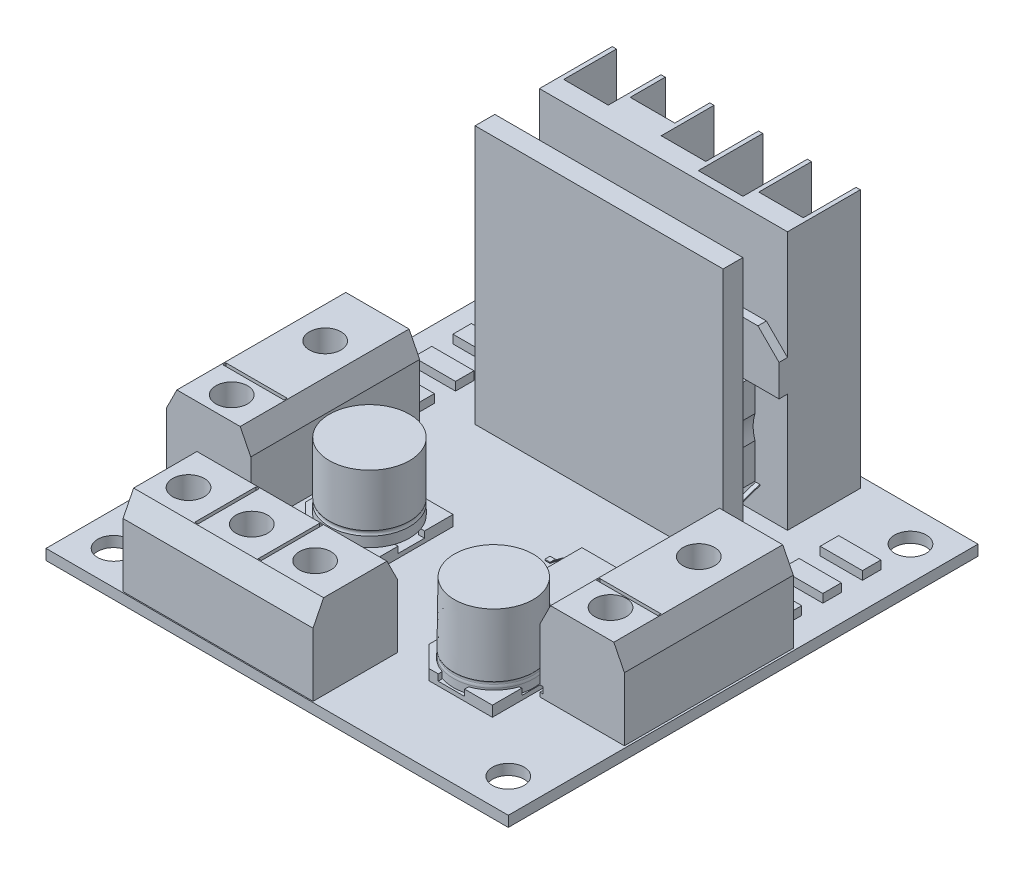
from build123d import *

# Parameters (mm, degrees)
SKETCH1_W                      = 43.8
SKETCH1_H                      = 44.5
BOSS_EXTRUDE1_DEPTH            = 1
SKETCH2_R                      = 1.5
CUT_EXTRUDE1_DEPTH             = 32.235756754
SKETCH3_W                      = 23.5
SKETCH3_H                      = 13
BOSS_EXTRUDE2_DEPTH            = 24.5
SKETCH4_W                      = 4.22
SKETCH4_H                      = 5
SKETCH4_H_2                    = 6.1
SKETCH4_H_3                    = 3.317704122
SKETCH4_W_2                    = 24.880307256
SKETCH4_H_4                    = 4.229463958
CUT_EXTRUDE2_DEPTH             = 24.5
SKETCH6_W                      = 17.564642357
SKETCH6_H                      = 8.68402444
BOSS_EXTRUDE3_DEPTH            = 2.5
CUT_EXTRUDE4_DEPTH             = 2.5
CUT_EXTRUDE5_DEPTH             = 2.5
SKETCH7_4_R                    = 0.503382287
CUT_EXTRUDE6_DEPTH             = 0.5
SKETCH7_5_R                    = 0.503382287
CUT_EXTRUDE7_DEPTH             = 0.5
BOSS_EXTRUDE4_DEPTH            = 0.8
CUT_EXTRUDE8_START             = -2.7
SKETCH9_R                      = 0.75
CUT_EXTRUDE8_DEPTH             = 2.7
SKETCH10_W                     = 8
SKETCH10_H                     = 16
BOSS_EXTRUDE5_DEPTH            = 8
CUT_EXTRUDE10_DEPTH            = 48.315430887
CUT_EXTRUDE11_DEPTH            = 48.315430887
SKETCH15_W                     = 5.8
SKETCH15_H                     = 0.3
CUT_EXTRUDE_THIN1_DEPTH        = 0.3
SKETCH16_W                     = 5.8
SKETCH16_H                     = 0.3
CUT_EXTRUDE_THIN2_DEPTH        = 0.3
SKETCH17_R                     = 1.5
CUT_EXTRUDE12_DEPTH            = 8
SKETCH18_W                     = 18
SKETCH18_H                     = 8
BOSS_EXTRUDE6_DEPTH            = 8
CUT_EXTRUDE13_DEPTH            = 50.848495464
SKETCH24_W                     = 0.3
SKETCH24_H                     = 5.8
CUT_EXTRUDE_THIN4_DEPTH        = 0.3
SKETCH25_R                     = 1.5
CUT_EXTRUDE14_DEPTH            = 8
BOSS_EXTRUDE8_DEPTH            = 0.3
SKETCH35_W                     = 7.841197797
SKETCH35_H                     = 7.810978509
BOSS_EXTRUDE9_DEPTH            = 0.8
BOSS_EXTRUDE11_START           = -1.5
BOSS_EXTRUDE11_DEPTH           = 0.3
BOSS_EXTRUDE12_START           = -6.5
BOSS_EXTRUDE12_DEPTH           = 0.3
BOSS_EXTRUDE13_START           = -4
BOSS_EXTRUDE13_DEPTH           = 0.3
BOSS_EXTRUDE14_DEPTH           = 1
CUT_EXTRUDE16_DEPTH            = 0.6
CUT_EXTRUDE17_START            = -1.4
SKETCH43_R                     = 0.15
CUT_EXTRUDE17_DEPTH            = 1.4
FILLET1_R                      = 1
SKETCH53_W                     = 4
SKETCH53_H                     = 1.75
BOSS_EXTRUDE18_DEPTH           = 0.8
SKETCH55_W                     = 0.5011709
SKETCH55_H                     = 0.5
BOSS_EXTRUDE20_DEPTH           = 0.1
BOSS_EXTRUDE21_DEPTH           = 1
CUT_EXTRUDE18_DEPTH            = 0.6
EXTRUDE_THIN1_START            = -3
EXTRUDE_THIN1_DEPTH            = 0.4
EXTRUDE_THIN9_START            = -6
EXTRUDE_THIN9_DEPTH            = 0.2
EXTRUDE_THIN11_START           = -8.6
EXTRUDE_THIN11_DEPTH           = 0.4
EXTRUDE_THIN13_START           = -12
EXTRUDE_THIN13_DEPTH           = 0.2
EXTRUDE_THIN14_START           = -15
EXTRUDE_THIN14_DEPTH           = 0.2
EXTRUDE_THIN15_START           = -18
EXTRUDE_THIN15_DEPTH           = 0.2
EXTRUDE_THIN16_START           = -21
EXTRUDE_THIN16_DEPTH           = 0.2
EXTRUDE_THIN17_START           = -24
EXTRUDE_THIN17_DEPTH           = 0.2
SKETCH158_R                    = 0.462614831
BOSS_EXTRUDE22_DEPTH           = 1
BOSS_EXTRUDE22_DRAFT           = 5
BOSS_EXTRUDE22_PROFILE_2_DEPTH = 1
BOSS_EXTRUDE22_PROFILE_2_DRAFT = 5
BOSS_EXTRUDE22_PROFILE_3_DEPTH = 1
BOSS_EXTRUDE22_PROFILE_3_DRAFT = 5
BOSS_EXTRUDE22_PROFILE_4_DEPTH = 1
BOSS_EXTRUDE22_PROFILE_4_DRAFT = 5
BOSS_EXTRUDE22_PROFILE_5_DEPTH = 1
BOSS_EXTRUDE22_PROFILE_5_DRAFT = 5
BOSS_EXTRUDE22_PROFILE_6_DEPTH = 1
BOSS_EXTRUDE22_PROFILE_6_DRAFT = 5
BOSS_EXTRUDE22_PROFILE_7_DEPTH = 1
BOSS_EXTRUDE22_PROFILE_7_DRAFT = 5
BOSS_EXTRUDE22_PROFILE_8_DEPTH = 1
BOSS_EXTRUDE22_PROFILE_8_DRAFT = 5
SKETCH160_R                    = 0.2
BOSS_EXTRUDE23_DEPTH           = 1
BOSS_EXTRUDE23_DRAFT           = 5
BOSS_EXTRUDE23_PROFILE_2_DEPTH = 1
BOSS_EXTRUDE23_PROFILE_2_DRAFT = 5
BOSS_EXTRUDE23_PROFILE_3_DEPTH = 1
BOSS_EXTRUDE23_PROFILE_3_DRAFT = 5
BOSS_EXTRUDE23_PROFILE_4_DEPTH = 1
BOSS_EXTRUDE23_PROFILE_4_DRAFT = 5
BOSS_EXTRUDE23_PROFILE_5_DEPTH = 1
BOSS_EXTRUDE23_PROFILE_5_DRAFT = 5
BOSS_EXTRUDE23_PROFILE_6_DEPTH = 1
BOSS_EXTRUDE23_PROFILE_6_DRAFT = 5
BOSS_EXTRUDE23_PROFILE_7_DEPTH = 1
BOSS_EXTRUDE23_PROFILE_7_DRAFT = 5
SKETCH156_R                    = 0.35
BOSS_EXTRUDE24_DEPTH           = 1
BOSS_EXTRUDE24_DRAFT           = 5
BOSS_EXTRUDE24_PROFILE_2_DEPTH = 1
BOSS_EXTRUDE24_PROFILE_2_DRAFT = 5
SKETCH141_R                    = 0.15
BOSS_EXTRUDE25_DEPTH           = 1
BOSS_EXTRUDE25_DRAFT           = 5
BOSS_EXTRUDE25_PROFILE_2_DEPTH = 1
BOSS_EXTRUDE25_PROFILE_2_DRAFT = 5
SKETCH138_R                    = 0.35
BOSS_EXTRUDE26_DEPTH           = 1
BOSS_EXTRUDE26_DRAFT           = 5
BOSS_EXTRUDE26_PROFILE_2_DEPTH = 1
BOSS_EXTRUDE26_PROFILE_2_DRAFT = 5
BOSS_EXTRUDE26_PROFILE_3_DEPTH = 1
BOSS_EXTRUDE26_PROFILE_3_DRAFT = 5
BOSS_EXTRUDE26_PROFILE_4_DEPTH = 1
BOSS_EXTRUDE26_PROFILE_4_DRAFT = 5
SKETCH102_R                    = 1.268566962
BOSS_EXTRUDE27_DEPTH           = 1
BOSS_EXTRUDE27_DRAFT           = -5
SKETCH150_R                    = 0.5
BOSS_EXTRUDE28_DEPTH           = 1
BOSS_EXTRUDE28_DRAFT           = 5
BOSS_EXTRUDE28_PROFILE_2_DEPTH = 1
BOSS_EXTRUDE28_PROFILE_2_DRAFT = 5
BOSS_EXTRUDE28_PROFILE_3_DEPTH = 1
BOSS_EXTRUDE28_PROFILE_3_DRAFT = 5


# Read off the part's stored shape, not the designer's step: Extrude-Thin1
with BuildPart() as part:
    # Sketch1 → Boss-Extrude1 (new body)
    with BuildSketch(Plane(origin=(0, 0, 0), x_dir=(1, 0, 0), z_dir=(0, 1, 0))):
        Rectangle(SKETCH1_W, SKETCH1_H)
    extrude(amount=BOSS_EXTRUDE1_DEPTH)

    # Sketch2 → Cut-Extrude1 (cut, through all)
    with BuildSketch(Plane(origin=(0, 1, 0), x_dir=(1, 0, 0), z_dir=(0, 1, 0))):
        with Locations(Location((18.7, -19.05, 0), (0, 0, 270))):
            Circle(SKETCH2_R)
        with Locations(Location((18.7, 19.05, 0), (0, 0, 90))):
            Circle(SKETCH2_R)
        with Locations(Location((-18.7, 19.05, 0), (0, 0, 270))):
            Circle(SKETCH2_R)
        with Locations(Location((-18.7, -19.05, 0), (0, 0, 90))):
            Circle(SKETCH2_R)
    extrude(amount=-CUT_EXTRUDE1_DEPTH, mode=Mode.SUBTRACT)

    # Sketch3 → Boss-Extrude2 (add)
    with BuildSketch(Plane(origin=(0, 1, 0), x_dir=(1, 0, 0), z_dir=(0, 1, 0))):
        with Locations((0, 14.75)):
            Rectangle(SKETCH3_W, SKETCH3_H)
    extrude(amount=BOSS_EXTRUDE2_DEPTH)

    # Sketch4 → Cut-Extrude2 (cut)
    with BuildSketch(Plane(origin=(0, 25.5, 0), x_dir=(1, 0, 0), z_dir=(0, 1, 0))):
        with Locations((9.24, 18.75)):
            Rectangle(SKETCH4_W, SKETCH4_H)
        with Locations((4.62, 18.2)):
            Rectangle(SKETCH4_W, SKETCH4_H_2)
        with Locations((0, 18.75)):
            Rectangle(SKETCH4_W, SKETCH4_H)
        with Locations((-4.62, 19.591147939)):
            Rectangle(SKETCH4_W, SKETCH4_H_3)
        with Locations((-9.24, 18.75)):
            Rectangle(SKETCH4_W, SKETCH4_H)
        with Locations((0, 12.235268021)):
            Rectangle(SKETCH4_W_2, SKETCH4_H_4)
    extrude(amount=-CUT_EXTRUDE2_DEPTH, mode=Mode.SUBTRACT)

    # Sketch6 → Boss-Extrude3 (add)
    with BuildSketch(Plane.XY.offset(-14.35)):
        with Locations((-0.108731681, 7.84201222)):
            Rectangle(SKETCH6_W, SKETCH6_H)
    extrude(amount=BOSS_EXTRUDE3_DEPTH)

    # Sketch7 → Cut-Extrude4 (cut)
    with BuildSketch(Plane.XY.offset(-11.85)):
        with BuildLine():
            Line((-12.257616989, 4.391445561), (-8.891052859, 9.047721401))
            ThreePointArc((-8.891052859, 9.047721401), (-9.384697797, 5.859456243), (-12.257616989, 4.391445561))
        make_face()
    extrude(amount=-CUT_EXTRUDE4_DEPTH, mode=Mode.SUBTRACT)

    # Sketch7<3> → Cut-Extrude5 (cut)
    with BuildSketch(Plane.XY.offset(-11.85)):
        with BuildLine():
            Line((12.040153628, 4.391445561), (8.673589498, 9.047721401))
            ThreePointArc((8.673589498, 9.047721401), (9.167234436, 5.859456243), (12.040153628, 4.391445561))
        make_face()
    extrude(amount=-CUT_EXTRUDE5_DEPTH, mode=Mode.SUBTRACT)

    # Sketch7<4> → Cut-Extrude6 (cut)
    with BuildSketch(Plane.XY.offset(-11.85)):
        with Locations((-8.755958637, 7.936624141)):
            Circle(SKETCH7_4_R)
    extrude(amount=-CUT_EXTRUDE6_DEPTH, mode=Mode.SUBTRACT)

    # Sketch7<5> → Cut-Extrude7 (cut)
    with BuildSketch(Plane.XY.offset(-11.85)):
        with Locations((8.538495276, 7.936624141)):
            Circle(SKETCH7_5_R)
    extrude(amount=-CUT_EXTRUDE7_DEPTH, mode=Mode.SUBTRACT)

    # Sketch8 → Boss-Extrude4 (add)
    with BuildSketch(Plane.XY.offset(-14.35)):
        Polygon((-9.75, 17.18402444), (-11.75, 15.18402444), (-11.75, 12.18402444), (11.75, 12.18402444), (11.75, 15.18402444), (9.75, 17.18402444), align=None)
    extrude(amount=BOSS_EXTRUDE4_DEPTH)

    # Sketch9 → Cut-Extrude8 (cut)
    with BuildSketch(Plane.XY.offset(-13.55).offset(CUT_EXTRUDE8_START)):
        with Locations((0.109256611, 14.873248282)):
            Circle(SKETCH9_R)
    extrude(amount=CUT_EXTRUDE8_DEPTH, mode=Mode.SUBTRACT)

    # Sketch10 → Boss-Extrude5 (add)
    with BuildSketch(Plane(origin=(0, 1, 0), x_dir=(1, 0, 0), z_dir=(0, 1, 0))):
        with Locations((17.7, -3.05)):
            Rectangle(SKETCH10_W, SKETCH10_H)
        with Locations((-17.7, -3.05)):
            Rectangle(SKETCH10_W, SKETCH10_H)
    extrude(amount=BOSS_EXTRUDE5_DEPTH)

    # Sketch13 → Cut-Extrude10 (cut, through all)
    with BuildSketch(Plane.XY.offset(11.05)):
        Polygon((-14.7, 9), (-13.7, 7), (-13.7, 9), align=None)
        Polygon((-21.7, 9), (-20.7, 9), (-21.7, 7), align=None)
    extrude(amount=-CUT_EXTRUDE10_DEPTH, mode=Mode.SUBTRACT)

    # Sketch14 → Cut-Extrude11 (cut, through all)
    with BuildSketch(Plane.XY.offset(11.05)):
        Polygon((20.7, 9), (21.7, 7), (21.7, 9), align=None)
        Polygon((13.7, 9), (14.7, 9), (13.7, 7), align=None)
    extrude(amount=-CUT_EXTRUDE11_DEPTH, mode=Mode.SUBTRACT)

    # Sketch15 → Cut-Extrude-Thin1 (cut)
    with BuildSketch(Plane(origin=(0, 9, 0), x_dir=(1, 0, 0), z_dir=(0, 1, 0))):
        with Locations((-17.7, -6.656281373)):
            Rectangle(SKETCH15_W, SKETCH15_H)
    extrude(amount=-CUT_EXTRUDE_THIN1_DEPTH, mode=Mode.SUBTRACT)

    # Sketch16 → Cut-Extrude-Thin2 (cut)
    with BuildSketch(Plane(origin=(0, 9, 0), x_dir=(1, 0, 0), z_dir=(0, 1, 0))):
        with Locations((17.7, -6.636285341)):
            Rectangle(SKETCH16_W, SKETCH16_H)
    extrude(amount=-CUT_EXTRUDE_THIN2_DEPTH, mode=Mode.SUBTRACT)

    # Sketch17 → Cut-Extrude12 (cut)
    with BuildSketch(Plane(origin=(0, 9, 0), x_dir=(1, 0, 0), z_dir=(0, 1, 0))):
        with Locations(Location((-17.7, 0, 0), (0, 0, 270))):
            Circle(SKETCH17_R)
        with Locations(Location((-17.7, -8.853635112, 0), (0, 0, 270))):
            Circle(SKETCH17_R)
        with Locations(Location((17.7, 0, 0), (0, 0, 270))):
            Circle(SKETCH17_R)
        with Locations(Location((17.7, -8.363166519, 0), (0, 0, 270))):
            Circle(SKETCH17_R)
    extrude(amount=-CUT_EXTRUDE12_DEPTH, mode=Mode.SUBTRACT)

    # Sketch18 → Boss-Extrude6 (add)
    with BuildSketch(Plane(origin=(0, 1, 0), x_dir=(1, 0, 0), z_dir=(0, 1, 0))):
        with Locations((-5.7, -18.15)):
            Rectangle(SKETCH18_W, SKETCH18_H)
    extrude(amount=BOSS_EXTRUDE6_DEPTH)

    # Sketch23 → Cut-Extrude13 (cut, through all)
    with BuildSketch(Plane.ZY.offset(14.7)):
        Polygon((21.15, 9), (22.15, 7), (22.15, 9), align=None)
        Polygon((14.15, 9), (15.15, 9), (14.15, 7), align=None)
    extrude(amount=-CUT_EXTRUDE13_DEPTH, mode=Mode.SUBTRACT)

    # Sketch24 → Cut-Extrude-Thin4 (cut)
    with BuildSketch(Plane(origin=(0, 9, 0), x_dir=(1, 0, 0), z_dir=(0, 1, 0))):
        with Locations((-8.85, -18.15)):
            Rectangle(SKETCH24_W, SKETCH24_H)
        with Locations((-2.85, -18.15)):
            Rectangle(SKETCH24_W, SKETCH24_H)
    extrude(amount=-CUT_EXTRUDE_THIN4_DEPTH, mode=Mode.SUBTRACT)

    # Sketch25 → Cut-Extrude14 (cut)
    with BuildSketch(Plane(origin=(0, 9, 0), x_dir=(1, 0, 0), z_dir=(0, 1, 0))):
        with Locations(Location((-12.137148341, -18.512532627, 0), (0, 0, 270))):
            Circle(SKETCH25_R)
        with Locations(Location((-6.137148394, -18.513331325, 0), (0, 0, 270))):
            Circle(SKETCH25_R)
        with Locations(Location((-0.137148458, -18.5142116, 0), (0, 0, 270))):
            Circle(SKETCH25_R)
    extrude(amount=-CUT_EXTRUDE14_DEPTH, mode=Mode.SUBTRACT)

    # Sketch33 → Boss-Extrude8 (add)
    with BuildSketch(Plane(origin=(0, 1, 0), x_dir=(1, 0, 0), z_dir=(0, 1, 0))):
        with BuildLine():
            Line((12.762823906, 0), (13.762823906, 0))
            Line((13.762823906, 0), (13.762823906, 0.641303759))
            ThreePointArc((13.762823906, 0.641303759), (13.19560981, 1.742127362), (12.08900437, 2.297977011))
            Line((12.08900437, 2.297977011), (4.324251532, 2.297977011))
            Line((4.324251532, 2.297977011), (4.324251532, -5.913001498))
            Line((4.324251532, -5.913001498), (11.709067969, -5.913001498))
            Line((11.709067969, -5.913001498), (11.820298955, -5.913001498))
            ThreePointArc((11.820298955, -5.913001498), (13.168026629, -5.338775955), (13.762823906, -4))
            Line((13.762823906, -4), (12.762823906, -4))
            Line((12.762823906, -4), (12.762823906, 0))
        make_face()
    extrude(amount=BOSS_EXTRUDE8_DEPTH)

    # Sketch35 → Boss-Extrude9 (add)
    with BuildSketch(Plane(origin=(0, 1.3, 0), x_dir=(1, 0, 0), z_dir=(0, 1, 0))):
        with Locations((8.444850431, -1.807512244)):
            Rectangle(SKETCH35_W, SKETCH35_H)
    extrude(amount=BOSS_EXTRUDE9_DEPTH)

    # Sketch36 → Boss-Extrude11 (add)
    with BuildSketch(Plane.XY.offset(5.713001498).offset(BOSS_EXTRUDE11_START)):
        Polygon((4.524251532, 1.7), (4.024251532, 1.602736799), (3.226311464, 1), (2.857820216, 1), (2.857820216, 1.066040562), (3.226311464, 1.066040562), (4.024251532, 1.668777361), (4.524251532, 1.766040562), align=None)
    extrude(amount=BOSS_EXTRUDE11_DEPTH)

    # Sketch38 → Boss-Extrude12 (add)
    with BuildSketch(Plane.XY.offset(5.713001498).offset(BOSS_EXTRUDE12_START)):
        Polygon((4.524251532, 1.7), (4.524251532, 1.766040562), (4.024251532, 1.668777361), (3.226311464, 1.066040562), (2.857820216, 1.066040562), (2.857820216, 1), (3.226311464, 1), (4.024251532, 1.602736799), align=None)
    extrude(amount=BOSS_EXTRUDE12_DEPTH)

    # Sketch39 → Boss-Extrude13 (add)
    with BuildSketch(Plane.XY.offset(5.713001498).offset(BOSS_EXTRUDE13_START)):
        Polygon((4.524251532, 1.766040562), (4.024251532, 1.668777361), (4.024251532, 1.602736799), (4.524251532, 1.7), align=None)
    extrude(amount=BOSS_EXTRUDE13_DEPTH)

    # Sketch40 → Boss-Extrude14 (add)
    with BuildSketch(Plane(origin=(0, 1, 0), x_dir=(1, 0, 0), z_dir=(0, 1, 0))):
        Polygon((7.107677283, -6.968030347), (5.107677283, -8.968030347), (5.107677283, -12.968030347), (7.107677283, -14.968030347), (13.107677283, -14.968030347), (13.107677283, -6.968030347), align=None)
    extrude(amount=BOSS_EXTRUDE14_DEPTH)

    # Sketch42 → Cut-Extrude16 (cut)
    with BuildSketch(Plane(origin=(0, 2, 0), x_dir=(1, 0, 0), z_dir=(0, 1, 0))):
        with BuildLine():
            Line((4.456914655, -9.680217803), (5.56786682, -9.680217803))
            ThreePointArc((5.56786682, -9.680217803), (6.492665198, -8.196274855), (7.976608146, -7.271476478))
            Line((7.976608146, -7.271476478), (7.976608146, -6.160524313))
            Line((7.976608146, -6.160524313), (10.476608146, -6.160524313))
            Line((10.476608146, -6.160524313), (10.476608146, -7.271476478))
            ThreePointArc((10.476608146, -7.271476478), (11.960551093, -8.196274855), (12.885349471, -9.680217803))
            Line((12.885349471, -9.680217803), (13.996301636, -9.680217803))
            Line((13.996301636, -9.680217803), (13.996301636, -12.180217803))
            Line((13.996301636, -12.180217803), (12.885349471, -12.180217803))
            ThreePointArc((12.885349471, -12.180217803), (11.960551093, -13.664160751), (10.476608146, -14.588959128))
            Line((10.476608146, -14.588959128), (10.476608146, -15.699911294))
            Line((10.476608146, -15.699911294), (7.976608146, -15.699911294))
            Line((7.976608146, -15.699911294), (7.976608146, -14.588959128))
            ThreePointArc((7.976608146, -14.588959128), (6.492665198, -13.664160751), (5.56786682, -12.180217803))
            Line((5.56786682, -12.180217803), (4.456914655, -12.180217803))
            Line((4.456914655, -12.180217803), (4.456914655, -9.680217803))
        make_face()
    extrude(amount=-CUT_EXTRUDE16_DEPTH, mode=Mode.SUBTRACT)

    # Sketch43 → Cut-Extrude17 (cut)
    with BuildSketch(Plane(origin=(0, 1.4, 0), x_dir=(1, 0, 0), z_dir=(0, 1, 0)).offset(CUT_EXTRUDE17_START)):
        with Locations(Location((10.357677283, -10.930217803, 0), (0, 0, 270))):
            Circle(SKETCH43_R)
        with Locations(Location((7.857677283, -10.930217803, 0), (0, 0, 270))):
            Circle(SKETCH43_R)
    extrude(amount=CUT_EXTRUDE17_DEPTH, mode=Mode.SUBTRACT)

    # Sketch47 → Revolve3 (revolve)
    with BuildSketch(Plane.XY.offset(10.968030347), mode=Mode.PRIVATE) as revolve3_sk:
        with BuildLine():
            Line((9.240695638, 1.4), (9.240695638, 8.594120878))
            Line((9.240695638, 8.594120878), (12.976476085, 8.594120878))
            Line((12.976476085, 8.594120878), (13.047154119, 2.672499992))
            ThreePointArc((13.047154119, 2.672499992), (12.99526862, 2.50906555), (13.047154119, 2.345631109))
            Line((13.047154119, 2.345631109), (13.047154119, 1.4))
            Line((13.047154119, 1.4), (9.240695638, 1.4))
        make_face()
    revolve(revolve3_sk.sketch.rotate(Axis((9.240695638, 1.4, 10.968030347), (0, 1, 0)), 90), axis=Axis((9.240695638, 1.4, 10.968030347), (0, 1, 0)))

    # Fillet1
    fillet1_edges = [part.edges().sort_by_distance(p)[0] for p in [
        (9.240695638, 2.345631109, 14.774488828),
    ]]
    fillet(fillet1_edges, radius=FILLET1_R)

    # Sketch53 → Boss-Extrude18 (add)
    with BuildSketch(Plane(origin=(0, 1, 0), x_dir=(1, 0, 0), z_dir=(0, 1, 0))):
        with Locations((-17.4, 14.675)):
            Rectangle(SKETCH53_W, SKETCH53_H)
        with Locations((-17.4, 10.925)):
            Rectangle(SKETCH53_W, SKETCH53_H)
        with Locations((-17.4, 7.175)):
            Rectangle(SKETCH53_W, SKETCH53_H)
        with Locations((-17.4, 3.425)):
            Rectangle(SKETCH53_W, SKETCH53_H)
        with Locations((17.4, 3.425)):
            Rectangle(SKETCH53_W, SKETCH53_H)
        with Locations((17.4, 7.175)):
            Rectangle(SKETCH53_W, SKETCH53_H)
        with Locations((17.4, 10.925)):
            Rectangle(SKETCH53_W, SKETCH53_H)
        with Locations((17.4, 14.675)):
            Rectangle(SKETCH53_W, SKETCH53_H)
    extrude(amount=BOSS_EXTRUDE18_DEPTH)

    # Sketch55 → Boss-Extrude20 (add)
    with BuildSketch(Plane(origin=(0, 1, 0), x_dir=(1, 0, 0), z_dir=(0, 1, 0))):
        with Locations((2.969817381, 0.636998502)):
            Rectangle(SKETCH55_W, SKETCH55_H)
        with Locations((2.969817381, -4.363001498)):
            Rectangle(SKETCH55_W, SKETCH55_H)
    extrude(amount=BOSS_EXTRUDE20_DEPTH)

    # Sketch27 → Boss-Extrude21 (add)
    with BuildSketch(Plane(origin=(0, 1, 0), x_dir=(1, 0, 0), z_dir=(0, 1, 0))):
        Polygon((-4.401522231, -1.180413666), (-4.401522231, -9.180413666), (-10.401522231, -9.180413666), (-12.401522231, -7.180413666), (-12.401522231, -3.180413666), (-10.401522231, -1.180413666), align=None)
    extrude(amount=BOSS_EXTRUDE21_DEPTH)

    # Sketch58 → Cut-Extrude18 (cut)
    with BuildSketch(Plane(origin=(0, 2, 0), x_dir=(1, 0, 0), z_dir=(0, 1, 0))):
        with BuildLine():
            Line((-4.957184625, -3.890413666), (-3.847184625, -3.890413666))
            Line((-3.847184625, -3.890413666), (-3.847184625, -6.390413666))
            Line((-3.847184625, -6.390413666), (-4.927599481, -6.390413666))
            ThreePointArc((-4.927599481, -6.390413666), (-5.743682542, -7.698169771), (-7.031522231, -8.545333586))
            Line((-7.031522231, -8.545333586), (-7.031522231, -9.685617448))
            Line((-7.031522231, -9.685617448), (-9.531522231, -9.685617448))
            Line((-9.531522231, -9.685617448), (-9.531522231, -8.575617448))
            ThreePointArc((-9.531522231, -8.575617448), (-10.870565085, -7.729220992), (-11.717334042, -6.390413666))
            Line((-11.717334042, -6.390413666), (-12.797748897, -6.390413666))
            Line((-12.797748897, -6.390413666), (-12.797748897, -3.890413666))
            Line((-12.797748897, -3.890413666), (-11.687748897, -3.890413666))
            ThreePointArc((-11.687748897, -3.890413666), (-10.840226057, -2.601632563), (-9.531522231, -1.785209884))
            Line((-9.531522231, -1.785209884), (-9.531522231, -0.705493745))
            Line((-9.531522231, -0.705493745), (-7.031522231, -0.705493745))
            Line((-7.031522231, -0.705493745), (-7.031522231, -1.815493745))
            ThreePointArc((-7.031522231, -1.815493745), (-5.773656282, -2.632318496), (-4.957184625, -3.890413666))
        make_face()
    extrude(amount=-CUT_EXTRUDE18_DEPTH, mode=Mode.SUBTRACT)

    # Sketch63 → Revolve4 (revolve)
    with BuildSketch(Plane.XY.offset(5.180413666), mode=Mode.PRIVATE) as revolve4_sk:
        with BuildLine():
            Line((-8.322466761, 2), (-8.322466761, 8.356365778))
            Line((-8.322466761, 8.356365778), (-4.517256135, 8.356365778))
            Line((-4.517256135, 8.356365778), (-4.517256135, 3.390757942))
            ThreePointArc((-4.517256135, 3.390757942), (-4.587050367, 3.168038788), (-4.517256135, 2.945319633))
            Line((-4.517256135, 2.945319633), (-4.517256135, 2))
            Line((-4.517256135, 2), (-8.322466761, 2))
        make_face()
    revolve(revolve4_sk.sketch.rotate(Axis((-8.322466761, 2, 5.180413666), (0, 1, 0)), 90), axis=Axis((-8.322466761, 2, 5.180413666), (0, 1, 0)))

    # Sketch78 → Extrude-Thin9 (add, symmetric)
    with BuildSketch(Plane(origin=(11.75, 0, 0), x_dir=(0, 0, -1), z_dir=(1, 0, 0)).offset(EXTRUDE_THIN9_START)):
        with BuildLine():
            ThreePointArc((14.873018915, 3.548791252), (12.141953918, 2.594523939), (9.702905754, 1.038764902))
            Line((9.702905754, 1.038764902), (9.766065309, 0.961235098))
            ThreePointArc((9.766065309, 0.961235098), (12.185627821, 2.504565114), (14.894874233, 3.451208748))
            Line((14.894874233, 3.451208748), (14.873018915, 3.548791252))
        make_face()
    extrude(amount=EXTRUDE_THIN9_DEPTH, both=True)

    # Sketch79 → Extrude-Thin11 (add)
    with BuildSketch(Plane(origin=(11.75, 0, 0), x_dir=(0, 0, -1), z_dir=(1, 0, 0)).offset(EXTRUDE_THIN11_START)):
        with BuildLine():
            ThreePointArc((14.873018915, 3.548791252), (12.141953918, 2.594523939), (9.702905754, 1.038764902))
            Line((9.702905754, 1.038764902), (9.766065309, 0.961235098))
            ThreePointArc((9.766065309, 0.961235098), (12.185627821, 2.504565114), (14.894874233, 3.451208748))
            Line((14.894874233, 3.451208748), (14.873018915, 3.548791252))
        make_face()
    extrude(amount=-EXTRUDE_THIN11_DEPTH)

    # Sketch80 → Extrude-Thin13 (add, symmetric)
    with BuildSketch(Plane(origin=(11.75, 0, 0), x_dir=(0, 0, -1), z_dir=(1, 0, 0)).offset(EXTRUDE_THIN13_START)):
        with BuildLine():
            ThreePointArc((14.8736161, 3.548921174), (12.134205434, 2.610484146), (9.702434295, 1.038376011))
            Line((9.702434295, 1.038376011), (9.766536768, 0.961623989))
            ThreePointArc((9.766536768, 0.961623989), (12.177879337, 2.520525321), (14.894277048, 3.451078826))
            Line((14.894277048, 3.451078826), (14.8736161, 3.548921174))
        make_face()
    extrude(amount=EXTRUDE_THIN13_DEPTH, both=True)

    # Sketch81 → Extrude-Thin14 (add, symmetric)
    with BuildSketch(Plane(origin=(11.75, 0, 0), x_dir=(0, 0, -1), z_dir=(1, 0, 0)).offset(EXTRUDE_THIN14_START)):
        with BuildLine():
            ThreePointArc((14.87437607, 3.549075508), (12.124356693, 2.63077043), (9.70184297, 1.037874307))
            Line((9.70184297, 1.037874307), (9.767128094, 0.962125693))
            ThreePointArc((9.767128094, 0.962125693), (12.168030596, 2.540811605), (14.893517078, 3.450924492))
            Line((14.893517078, 3.450924492), (14.87437607, 3.549075508))
        make_face()
    extrude(amount=EXTRUDE_THIN14_DEPTH, both=True)

    # Sketch82 → Extrude-Thin15 (add, symmetric)
    with BuildSketch(Plane(origin=(11.75, 0, 0), x_dir=(0, 0, -1), z_dir=(1, 0, 0)).offset(EXTRUDE_THIN15_START)):
        with BuildLine():
            ThreePointArc((14.874081789, 3.549017201), (12.128169019, 2.622917858), (9.702070803, 1.038069481))
            Line((9.702070803, 1.038069481), (9.76690026, 0.961930519))
            ThreePointArc((9.76690026, 0.961930519), (12.171842922, 2.532959033), (14.893811359, 3.450982799))
            Line((14.893811359, 3.450982799), (14.874081789, 3.549017201))
        make_face()
    extrude(amount=EXTRUDE_THIN15_DEPTH, both=True)

    # Sketch83 → Extrude-Thin16 (add, symmetric)
    with BuildSketch(Plane(origin=(11.75, 0, 0), x_dir=(0, 0, -1), z_dir=(1, 0, 0)).offset(EXTRUDE_THIN16_START)):
        with BuildLine():
            ThreePointArc((14.87474175, 3.549145409), (12.119621451, 2.640524007), (9.701561864, 1.037630202))
            Line((9.701561864, 1.037630202), (9.767409199, 0.962369798))
            ThreePointArc((9.767409199, 0.962369798), (12.163295354, 2.550565182), (14.893151398, 3.450854591))
            Line((14.893151398, 3.450854591), (14.87474175, 3.549145409))
        make_face()
    extrude(amount=EXTRUDE_THIN16_DEPTH, both=True)

    # Sketch84 → Extrude-Thin17 (add, symmetric)
    with BuildSketch(Plane(origin=(11.75, 0, 0), x_dir=(0, 0, -1), z_dir=(1, 0, 0)).offset(EXTRUDE_THIN17_START)):
        with BuildLine():
            ThreePointArc((14.874371079, 3.549074534), (12.124421333, 2.630637284), (9.701846822, 1.037877627))
            Line((9.701846822, 1.037877627), (9.767124242, 0.962122373))
            ThreePointArc((9.767124242, 0.962122373), (12.168095237, 2.540678459), (14.893522069, 3.450925466))
            Line((14.893522069, 3.450925466), (14.874371079, 3.549074534))
        make_face()
    extrude(amount=EXTRUDE_THIN17_DEPTH, both=True)


with BuildPart() as body_2:
    # Extrude-Thin1 outline → Extrude-Thin1 (new body)
    with BuildSketch(Plane(origin=(11.75, 0, 0), x_dir=(0, 0, -1), z_dir=(1, 0, 0)).offset(EXTRUDE_THIN1_START)):
        with BuildLine():
            Line((14.883946574, 3.5), (14.862091257, 3.597582504))
            add(Edge.make_bspline(
                [(14.862091257, 3.597582504), (12.812869893, 3.138623353), (11.079883192, 2.298012947), (9.66900251, 1.075577601)],
                knots=[0, 0, 0, 0, 1, 1, 1, 1], degree=3))
            Line((9.66900251, 1.075577601), (9.734485532, 1))
            add(Edge.make_bspline(
                [(14.883946574, 3.5), (11.830606208, 2.816150746), (9.734485532, 1)],
                knots=[0, 0, 0, 1, 1, 1], degree=2))
        make_face()
    extrude(amount=EXTRUDE_THIN1_DEPTH)


with BuildPart() as boss_extrude22_tool:
    # Sketch158 → Boss-Extrude22 (with draft: the straight prism first)
    with BuildSketch(Plane.XZ):
        with Locations((10.137311409, -9.84559552)):
            Circle(SKETCH158_R)
    extrude(amount=BOSS_EXTRUDE22_DEPTH)
    # Boss-Extrude22: the draft: its side faces are tilted about the plane it starts from
    boss_extrude22_sides = [boss_extrude22_tool.faces().sort_by_distance(p)[0] for p in [
        (9.674696578, -0.5, -9.84559552),
    ]]
    draft(boss_extrude22_sides, Plane.XZ, BOSS_EXTRUDE22_DRAFT)


with BuildPart() as part_1:
    add(part.part)

    # Boss-Extrude22: add boss_extrude22_tool
    add(boss_extrude22_tool.part)


with BuildPart() as boss_extrude22_profile_2_tool:
    # Sketch158 → Boss-Extrude22 profile 2 (with draft: the straight prism first)
    with BuildSketch(Plane.XZ):
        with Locations((6.937311409, -9.84559552)):
            Circle(SKETCH158_R)
    extrude(amount=BOSS_EXTRUDE22_PROFILE_2_DEPTH)
    # Boss-Extrude22 profile 2: the draft: its side faces are tilted about the plane it starts from
    boss_extrude22_profile_2_sides = [boss_extrude22_profile_2_tool.faces().sort_by_distance(p)[0] for p in [
        (6.474696578, -0.5, -9.84559552),
    ]]
    draft(boss_extrude22_profile_2_sides, Plane.XZ, BOSS_EXTRUDE22_PROFILE_2_DRAFT)


with BuildPart() as part_2:
    add(part_1.part)

    # Boss-Extrude22 profile 2: add boss_extrude22_profile_2_tool
    add(boss_extrude22_profile_2_tool.part)


with BuildPart() as boss_extrude22_profile_3_tool:
    # Sketch158 → Boss-Extrude22 profile 3 (with draft: the straight prism first)
    with BuildSketch(Plane.XZ):
        with Locations((4.137311409, -9.84559552)):
            Circle(SKETCH158_R)
    extrude(amount=BOSS_EXTRUDE22_PROFILE_3_DEPTH)
    # Boss-Extrude22 profile 3: the draft: its side faces are tilted about the plane it starts from
    boss_extrude22_profile_3_sides = [boss_extrude22_profile_3_tool.faces().sort_by_distance(p)[0] for p in [
        (3.674696578, -0.5, -9.84559552),
    ]]
    draft(boss_extrude22_profile_3_sides, Plane.XZ, BOSS_EXTRUDE22_PROFILE_3_DRAFT)


with BuildPart() as part_3:
    add(part_2.part)

    # Boss-Extrude22 profile 3: add boss_extrude22_profile_3_tool
    add(boss_extrude22_profile_3_tool.part)


with BuildPart() as boss_extrude22_profile_4_tool:
    # Sketch158 → Boss-Extrude22 profile 4 (with draft: the straight prism first)
    with BuildSketch(Plane.XZ):
        with Locations((0.937311409, -9.84559552)):
            Circle(SKETCH158_R)
    extrude(amount=BOSS_EXTRUDE22_PROFILE_4_DEPTH)
    # Boss-Extrude22 profile 4: the draft: its side faces are tilted about the plane it starts from
    boss_extrude22_profile_4_sides = [boss_extrude22_profile_4_tool.faces().sort_by_distance(p)[0] for p in [
        (0.474696578, -0.5, -9.84559552),
    ]]
    draft(boss_extrude22_profile_4_sides, Plane.XZ, BOSS_EXTRUDE22_PROFILE_4_DRAFT)


with BuildPart() as part_4:
    add(part_3.part)

    # Boss-Extrude22 profile 4: add boss_extrude22_profile_4_tool
    add(boss_extrude22_profile_4_tool.part)


with BuildPart() as boss_extrude22_profile_5_tool:
    # Sketch158 → Boss-Extrude22 profile 5 (with draft: the straight prism first)
    with BuildSketch(Plane.XZ):
        with Locations((-2.062688591, -9.84559552)):
            Circle(SKETCH158_R)
    extrude(amount=BOSS_EXTRUDE22_PROFILE_5_DEPTH)
    # Boss-Extrude22 profile 5: the draft: its side faces are tilted about the plane it starts from
    boss_extrude22_profile_5_sides = [boss_extrude22_profile_5_tool.faces().sort_by_distance(p)[0] for p in [
        (-2.525303422, -0.5, -9.84559552),
    ]]
    draft(boss_extrude22_profile_5_sides, Plane.XZ, BOSS_EXTRUDE22_PROFILE_5_DRAFT)


with BuildPart() as part_5:
    add(part_4.part)

    # Boss-Extrude22 profile 5: add boss_extrude22_profile_5_tool
    add(boss_extrude22_profile_5_tool.part)


with BuildPart() as boss_extrude22_profile_6_tool:
    # Sketch158 → Boss-Extrude22 profile 6 (with draft: the straight prism first)
    with BuildSketch(Plane.XZ):
        with Locations((-5.062688591, -9.84559552)):
            Circle(SKETCH158_R)
    extrude(amount=BOSS_EXTRUDE22_PROFILE_6_DEPTH)
    # Boss-Extrude22 profile 6: the draft: its side faces are tilted about the plane it starts from
    boss_extrude22_profile_6_sides = [boss_extrude22_profile_6_tool.faces().sort_by_distance(p)[0] for p in [
        (-5.525303422, -0.5, -9.84559552),
    ]]
    draft(boss_extrude22_profile_6_sides, Plane.XZ, BOSS_EXTRUDE22_PROFILE_6_DRAFT)


with BuildPart() as part_6:
    add(part_5.part)

    # Boss-Extrude22 profile 6: add boss_extrude22_profile_6_tool
    add(boss_extrude22_profile_6_tool.part)


with BuildPart() as boss_extrude22_profile_7_tool:
    # Sketch158 → Boss-Extrude22 profile 7 (with draft: the straight prism first)
    with BuildSketch(Plane.XZ):
        with Locations((-8.062688591, -9.84559552)):
            Circle(SKETCH158_R)
    extrude(amount=BOSS_EXTRUDE22_PROFILE_7_DEPTH)
    # Boss-Extrude22 profile 7: the draft: its side faces are tilted about the plane it starts from
    boss_extrude22_profile_7_sides = [boss_extrude22_profile_7_tool.faces().sort_by_distance(p)[0] for p in [
        (-8.525303422, -0.5, -9.84559552),
    ]]
    draft(boss_extrude22_profile_7_sides, Plane.XZ, BOSS_EXTRUDE22_PROFILE_7_DRAFT)


with BuildPart() as part_7:
    add(part_6.part)

    # Boss-Extrude22 profile 7: add boss_extrude22_profile_7_tool
    add(boss_extrude22_profile_7_tool.part)


with BuildPart() as boss_extrude22_profile_8_tool:
    # Sketch158 → Boss-Extrude22 profile 8 (with draft: the straight prism first)
    with BuildSketch(Plane.XZ):
        with Locations((-11.062688591, -9.84559552)):
            Circle(SKETCH158_R)
    extrude(amount=BOSS_EXTRUDE22_PROFILE_8_DEPTH)
    # Boss-Extrude22 profile 8: the draft: its side faces are tilted about the plane it starts from
    boss_extrude22_profile_8_sides = [boss_extrude22_profile_8_tool.faces().sort_by_distance(p)[0] for p in [
        (-11.525303422, -0.5, -9.84559552),
    ]]
    draft(boss_extrude22_profile_8_sides, Plane.XZ, BOSS_EXTRUDE22_PROFILE_8_DRAFT)


with BuildPart() as part_8:
    add(part_7.part)

    # Boss-Extrude22 profile 8: add boss_extrude22_profile_8_tool
    add(boss_extrude22_profile_8_tool.part)


with BuildPart() as boss_extrude23_tool:
    # Sketch160 → Boss-Extrude23 (with draft: the straight prism first)
    with BuildSketch(Plane.XZ):
        with Locations((8.437260058, -13.983299006)):
            Circle(SKETCH160_R)
    extrude(amount=BOSS_EXTRUDE23_DEPTH)
    # Boss-Extrude23: the draft: its side faces are tilted about the plane it starts from
    boss_extrude23_sides = [boss_extrude23_tool.faces().sort_by_distance(p)[0] for p in [
        (8.237260058, -0.5, -13.983299006),
    ]]
    draft(boss_extrude23_sides, Plane.XZ, BOSS_EXTRUDE23_DRAFT)


with BuildPart() as part_9:
    add(part_8.part)

    # Boss-Extrude23: add boss_extrude23_tool
    add(boss_extrude23_tool.part)


with BuildPart() as boss_extrude23_profile_2_tool:
    # Sketch160 → Boss-Extrude23 profile 2 (with draft: the straight prism first)
    with BuildSketch(Plane.XZ):
        with Locations((5.4351534, -13.983299006)):
            Circle(SKETCH160_R)
    extrude(amount=BOSS_EXTRUDE23_PROFILE_2_DEPTH)
    # Boss-Extrude23 profile 2: the draft: its side faces are tilted about the plane it starts from
    boss_extrude23_profile_2_sides = [boss_extrude23_profile_2_tool.faces().sort_by_distance(p)[0] for p in [
        (5.2351534, -0.5, -13.983299006),
    ]]
    draft(boss_extrude23_profile_2_sides, Plane.XZ, BOSS_EXTRUDE23_PROFILE_2_DRAFT)


with BuildPart() as part_10:
    add(part_9.part)

    # Boss-Extrude23 profile 2: add boss_extrude23_profile_2_tool
    add(boss_extrude23_profile_2_tool.part)


with BuildPart() as boss_extrude23_profile_3_tool:
    # Sketch160 → Boss-Extrude23 profile 3 (with draft: the straight prism first)
    with BuildSketch(Plane.XZ):
        with Locations((2.426080775, -13.983299006)):
            Circle(SKETCH160_R)
    extrude(amount=BOSS_EXTRUDE23_PROFILE_3_DEPTH)
    # Boss-Extrude23 profile 3: the draft: its side faces are tilted about the plane it starts from
    boss_extrude23_profile_3_sides = [boss_extrude23_profile_3_tool.faces().sort_by_distance(p)[0] for p in [
        (2.226080775, -0.5, -13.983299006),
    ]]
    draft(boss_extrude23_profile_3_sides, Plane.XZ, BOSS_EXTRUDE23_PROFILE_3_DRAFT)


with BuildPart() as part_11:
    add(part_10.part)

    # Boss-Extrude23 profile 3: add boss_extrude23_profile_3_tool
    add(boss_extrude23_profile_3_tool.part)


with BuildPart() as boss_extrude23_profile_4_tool:
    # Sketch160 → Boss-Extrude23 profile 4 (with draft: the straight prism first)
    with BuildSketch(Plane.XZ):
        with Locations((-0.567135446, -13.983299006)):
            Circle(SKETCH160_R)
    extrude(amount=BOSS_EXTRUDE23_PROFILE_4_DEPTH)
    # Boss-Extrude23 profile 4: the draft: its side faces are tilted about the plane it starts from
    boss_extrude23_profile_4_sides = [boss_extrude23_profile_4_tool.faces().sort_by_distance(p)[0] for p in [
        (-0.767135446, -0.5, -13.983299006),
    ]]
    draft(boss_extrude23_profile_4_sides, Plane.XZ, BOSS_EXTRUDE23_PROFILE_4_DRAFT)


with BuildPart() as part_12:
    add(part_11.part)

    # Boss-Extrude23 profile 4: add boss_extrude23_profile_4_tool
    add(boss_extrude23_profile_4_tool.part)


with BuildPart() as boss_extrude23_profile_5_tool:
    # Sketch160 → Boss-Extrude23 profile 5 (with draft: the straight prism first)
    with BuildSketch(Plane.XZ):
        with Locations((-3.558696395, -13.983299006)):
            Circle(SKETCH160_R)
    extrude(amount=BOSS_EXTRUDE23_PROFILE_5_DEPTH)
    # Boss-Extrude23 profile 5: the draft: its side faces are tilted about the plane it starts from
    boss_extrude23_profile_5_sides = [boss_extrude23_profile_5_tool.faces().sort_by_distance(p)[0] for p in [
        (-3.758696395, -0.5, -13.983299006),
    ]]
    draft(boss_extrude23_profile_5_sides, Plane.XZ, BOSS_EXTRUDE23_PROFILE_5_DRAFT)


with BuildPart() as part_13:
    add(part_12.part)

    # Boss-Extrude23 profile 5: add boss_extrude23_profile_5_tool
    add(boss_extrude23_profile_5_tool.part)


with BuildPart() as boss_extrude23_profile_6_tool:
    # Sketch160 → Boss-Extrude23 profile 6 (with draft: the straight prism first)
    with BuildSketch(Plane.XZ):
        with Locations((-6.569719979, -13.983299006)):
            Circle(SKETCH160_R)
    extrude(amount=BOSS_EXTRUDE23_PROFILE_6_DEPTH)
    # Boss-Extrude23 profile 6: the draft: its side faces are tilted about the plane it starts from
    boss_extrude23_profile_6_sides = [boss_extrude23_profile_6_tool.faces().sort_by_distance(p)[0] for p in [
        (-6.769719979, -0.5, -13.983299006),
    ]]
    draft(boss_extrude23_profile_6_sides, Plane.XZ, BOSS_EXTRUDE23_PROFILE_6_DRAFT)


with BuildPart() as part_14:
    add(part_13.part)

    # Boss-Extrude23 profile 6: add boss_extrude23_profile_6_tool
    add(boss_extrude23_profile_6_tool.part)


with BuildPart() as boss_extrude23_profile_7_tool:
    # Sketch160 → Boss-Extrude23 profile 7 (with draft: the straight prism first)
    with BuildSketch(Plane.XZ):
        with Locations((-9.596008921, -13.983299006)):
            Circle(SKETCH160_R)
    extrude(amount=BOSS_EXTRUDE23_PROFILE_7_DEPTH)
    # Boss-Extrude23 profile 7: the draft: its side faces are tilted about the plane it starts from
    boss_extrude23_profile_7_sides = [boss_extrude23_profile_7_tool.faces().sort_by_distance(p)[0] for p in [
        (-9.796008921, -0.5, -13.983299006),
    ]]
    draft(boss_extrude23_profile_7_sides, Plane.XZ, BOSS_EXTRUDE23_PROFILE_7_DRAFT)


with BuildPart() as part_15:
    add(part_14.part)

    # Boss-Extrude23 profile 7: add boss_extrude23_profile_7_tool
    add(boss_extrude23_profile_7_tool.part)


with BuildPart() as boss_extrude24_tool:
    # Sketch156 → Boss-Extrude24 (with draft: the straight prism first)
    with BuildSketch(Plane.XZ):
        with Locations((-5.235609552, 5.180413666)):
            Circle(SKETCH156_R)
    extrude(amount=BOSS_EXTRUDE24_DEPTH)
    # Boss-Extrude24: the draft: its side faces are tilted about the plane it starts from
    boss_extrude24_sides = [boss_extrude24_tool.faces().sort_by_distance(p)[0] for p in [
        (-5.585609552, -0.5, 5.180413666),
    ]]
    draft(boss_extrude24_sides, Plane.XZ, BOSS_EXTRUDE24_DRAFT)


with BuildPart() as part_16:
    add(part_15.part)

    # Boss-Extrude24: add boss_extrude24_tool
    add(boss_extrude24_tool.part)


with BuildPart() as boss_extrude24_profile_2_tool:
    # Sketch156 → Boss-Extrude24 profile 2 (with draft: the straight prism first)
    with BuildSketch(Plane.XZ):
        with Locations((-7.426116239, 5.180413666)):
            Circle(SKETCH156_R)
    extrude(amount=BOSS_EXTRUDE24_PROFILE_2_DEPTH)
    # Boss-Extrude24 profile 2: the draft: its side faces are tilted about the plane it starts from
    boss_extrude24_profile_2_sides = [boss_extrude24_profile_2_tool.faces().sort_by_distance(p)[0] for p in [
        (-7.776116239, -0.5, 5.180413666),
    ]]
    draft(boss_extrude24_profile_2_sides, Plane.XZ, BOSS_EXTRUDE24_PROFILE_2_DRAFT)


with BuildPart() as part_17:
    add(part_16.part)

    # Boss-Extrude24 profile 2: add boss_extrude24_profile_2_tool
    add(boss_extrude24_profile_2_tool.part)


with BuildPart() as body_3:
    # Sketch141 → Boss-Extrude25 (with draft: the straight prism first)
    with BuildSketch(Plane.XZ):
        with Locations(Location((10.357677283, 10.930217803, 0), (0, 0, 90))):
            Circle(SKETCH141_R)
    extrude(amount=BOSS_EXTRUDE25_DEPTH)
    # Boss-Extrude25: the draft: its side faces are tilted about the plane it starts from
    boss_extrude25_sides = [body_3.faces().sort_by_distance(p)[0] for p in [
        (10.357677283, -0.5, 10.780217803),
    ]]
    draft(boss_extrude25_sides, Plane.XZ, BOSS_EXTRUDE25_DRAFT)


with BuildPart() as body_4:
    # Sketch141 → Boss-Extrude25 profile 2 (with draft: the straight prism first)
    with BuildSketch(Plane.XZ):
        with Locations(Location((7.857677283, 10.930217803, 0), (0, 0, 90))):
            Circle(SKETCH141_R)
    extrude(amount=BOSS_EXTRUDE25_PROFILE_2_DEPTH)
    # Boss-Extrude25 profile 2: the draft: its side faces are tilted about the plane it starts from
    boss_extrude25_profile_2_sides = [body_4.faces().sort_by_distance(p)[0] for p in [
        (7.857677283, -0.5, 10.780217803),
    ]]
    draft(boss_extrude25_profile_2_sides, Plane.XZ, BOSS_EXTRUDE25_PROFILE_2_DRAFT)


with BuildPart() as boss_extrude26_tool:
    # Sketch138 → Boss-Extrude26 (with draft: the straight prism first)
    with BuildSketch(Plane.XZ):
        with Locations((17.7, 8.363166519)):
            Circle(SKETCH138_R)
    extrude(amount=BOSS_EXTRUDE26_DEPTH)
    # Boss-Extrude26: the draft: its side faces are tilted about the plane it starts from
    boss_extrude26_sides = [boss_extrude26_tool.faces().sort_by_distance(p)[0] for p in [
        (17.35, -0.5, 8.363166519),
    ]]
    draft(boss_extrude26_sides, Plane.XZ, BOSS_EXTRUDE26_DRAFT)


with BuildPart() as part_18:
    add(part_17.part)

    # Boss-Extrude26: add boss_extrude26_tool
    add(boss_extrude26_tool.part)


with BuildPart() as boss_extrude26_profile_2_tool:
    # Sketch138 → Boss-Extrude26 profile 2 (with draft: the straight prism first)
    with BuildSketch(Plane.XZ):
        with Locations((17.7, 0)):
            Circle(SKETCH138_R)
    extrude(amount=BOSS_EXTRUDE26_PROFILE_2_DEPTH)
    # Boss-Extrude26 profile 2: the draft: its side faces are tilted about the plane it starts from
    boss_extrude26_profile_2_sides = [boss_extrude26_profile_2_tool.faces().sort_by_distance(p)[0] for p in [
        (17.35, -0.5, 0),
    ]]
    draft(boss_extrude26_profile_2_sides, Plane.XZ, BOSS_EXTRUDE26_PROFILE_2_DRAFT)


with BuildPart() as part_19:
    add(part_18.part)

    # Boss-Extrude26 profile 2: add boss_extrude26_profile_2_tool
    add(boss_extrude26_profile_2_tool.part)


with BuildPart() as boss_extrude26_profile_3_tool:
    # Sketch138 → Boss-Extrude26 profile 3 (with draft: the straight prism first)
    with BuildSketch(Plane.XZ):
        with Locations((-17.7, 0)):
            Circle(SKETCH138_R)
    extrude(amount=BOSS_EXTRUDE26_PROFILE_3_DEPTH)
    # Boss-Extrude26 profile 3: the draft: its side faces are tilted about the plane it starts from
    boss_extrude26_profile_3_sides = [boss_extrude26_profile_3_tool.faces().sort_by_distance(p)[0] for p in [
        (-18.05, -0.5, 0),
    ]]
    draft(boss_extrude26_profile_3_sides, Plane.XZ, BOSS_EXTRUDE26_PROFILE_3_DRAFT)


with BuildPart() as part_20:
    add(part_19.part)

    # Boss-Extrude26 profile 3: add boss_extrude26_profile_3_tool
    add(boss_extrude26_profile_3_tool.part)


with BuildPart() as boss_extrude26_profile_4_tool:
    # Sketch138 → Boss-Extrude26 profile 4 (with draft: the straight prism first)
    with BuildSketch(Plane.XZ):
        with Locations((-17.7, 8.363166519)):
            Circle(SKETCH138_R)
    extrude(amount=BOSS_EXTRUDE26_PROFILE_4_DEPTH)
    # Boss-Extrude26 profile 4: the draft: its side faces are tilted about the plane it starts from
    boss_extrude26_profile_4_sides = [boss_extrude26_profile_4_tool.faces().sort_by_distance(p)[0] for p in [
        (-18.05, -0.5, 8.363166519),
    ]]
    draft(boss_extrude26_profile_4_sides, Plane.XZ, BOSS_EXTRUDE26_PROFILE_4_DRAFT)


with BuildPart() as part_21:
    add(part_20.part)

    # Boss-Extrude26 profile 4: add boss_extrude26_profile_4_tool
    add(boss_extrude26_profile_4_tool.part)


with BuildPart() as boss_extrude27_tool:
    # Sketch102 → Boss-Extrude27 (with draft: the straight prism first)
    with BuildSketch(Plane(origin=(0, 1, 0), x_dir=(1, 0, 0), z_dir=(0, 1, 0))):
        with Locations((-0.320830119, -18.655003284)):
            Circle(SKETCH102_R)
    extrude(amount=-BOSS_EXTRUDE27_DEPTH)
    # Boss-Extrude27: the draft: its side faces are tilted about the plane it starts from
    boss_extrude27_sides = [boss_extrude27_tool.faces().sort_by_distance(p)[0] for p in [
        (-1.589397082, 0.5, 18.655003284),
    ]]
    draft(boss_extrude27_sides, Plane(origin=(0, 1, 0), x_dir=(1, 0, 0), z_dir=(0, 1, 0)), BOSS_EXTRUDE27_DRAFT)


with BuildPart() as part_22:
    add(part_21.part)

    # Boss-Extrude27: add boss_extrude27_tool
    add(boss_extrude27_tool.part)


with BuildPart() as boss_extrude28_tool:
    # Sketch150 → Boss-Extrude28 (with draft: the straight prism first)
    with BuildSketch(Plane.XZ):
        with Locations((-0.137148458, 18.5142116)):
            Circle(SKETCH150_R)
    extrude(amount=BOSS_EXTRUDE28_DEPTH)
    # Boss-Extrude28: the draft: its side faces are tilted about the plane it starts from
    boss_extrude28_sides = [boss_extrude28_tool.faces().sort_by_distance(p)[0] for p in [
        (-0.637148458, -0.5, 18.5142116),
    ]]
    draft(boss_extrude28_sides, Plane.XZ, BOSS_EXTRUDE28_DRAFT)


with BuildPart() as part_23:
    add(part_22.part)

    # Boss-Extrude28: add boss_extrude28_tool
    add(boss_extrude28_tool.part)


with BuildPart() as boss_extrude28_profile_2_tool:
    # Sketch150 → Boss-Extrude28 profile 2 (with draft: the straight prism first)
    with BuildSketch(Plane.XZ):
        with Locations((-6.137148394, 18.513331325)):
            Circle(SKETCH150_R)
    extrude(amount=BOSS_EXTRUDE28_PROFILE_2_DEPTH)
    # Boss-Extrude28 profile 2: the draft: its side faces are tilted about the plane it starts from
    boss_extrude28_profile_2_sides = [boss_extrude28_profile_2_tool.faces().sort_by_distance(p)[0] for p in [
        (-6.637148394, -0.5, 18.513331325),
    ]]
    draft(boss_extrude28_profile_2_sides, Plane.XZ, BOSS_EXTRUDE28_PROFILE_2_DRAFT)


with BuildPart() as part_24:
    add(part_23.part)

    # Boss-Extrude28 profile 2: add boss_extrude28_profile_2_tool
    add(boss_extrude28_profile_2_tool.part)


with BuildPart() as boss_extrude28_profile_3_tool:
    # Sketch150 → Boss-Extrude28 profile 3 (with draft: the straight prism first)
    with BuildSketch(Plane.XZ):
        with Locations((-12.137148341, 18.512532627)):
            Circle(SKETCH150_R)
    extrude(amount=BOSS_EXTRUDE28_PROFILE_3_DEPTH)
    # Boss-Extrude28 profile 3: the draft: its side faces are tilted about the plane it starts from
    boss_extrude28_profile_3_sides = [boss_extrude28_profile_3_tool.faces().sort_by_distance(p)[0] for p in [
        (-12.637148341, -0.5, 18.512532627),
    ]]
    draft(boss_extrude28_profile_3_sides, Plane.XZ, BOSS_EXTRUDE28_PROFILE_3_DRAFT)


with BuildPart() as part_25:
    add(part_24.part)

    # Boss-Extrude28 profile 3: add boss_extrude28_profile_3_tool
    add(boss_extrude28_profile_3_tool.part)


solid = Compound([body_2.part, body_3.part, body_4.part, part_25.part])
